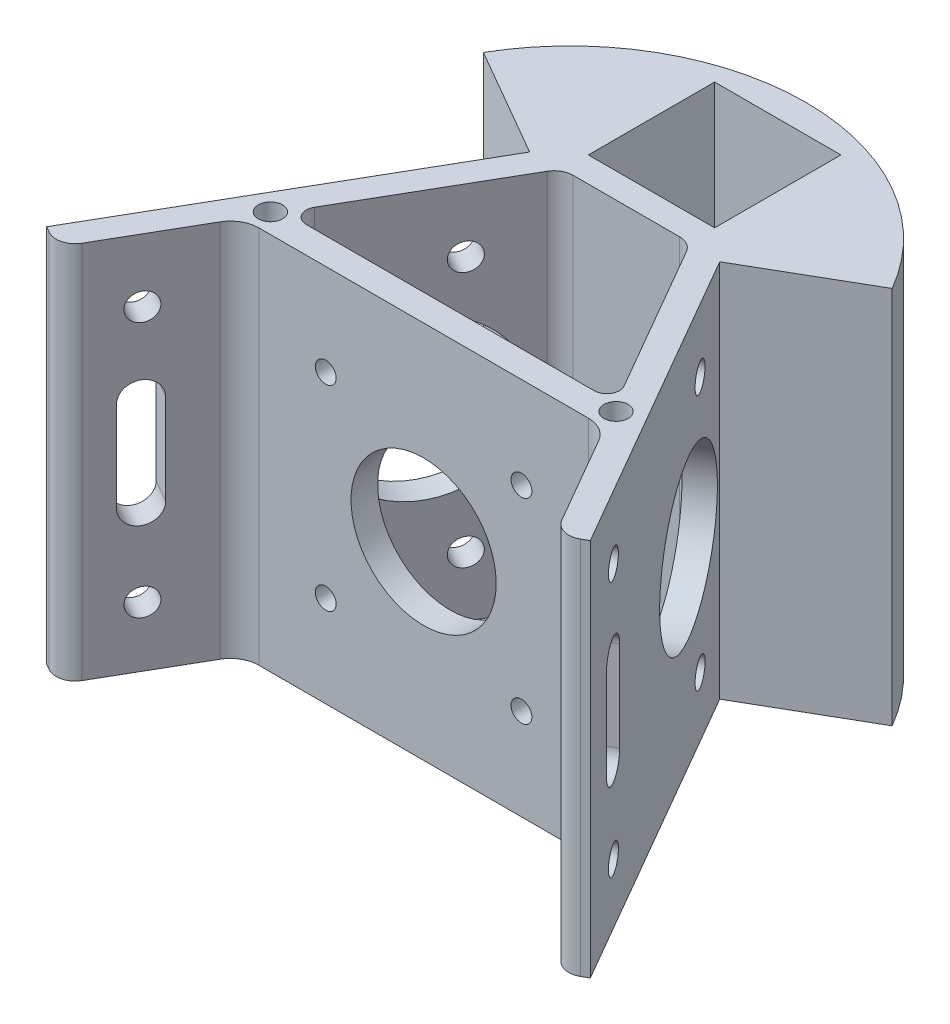
from build123d import *

# Parameters (mm, degrees)
BOSS_EXTRUDE1_DEPTH                = 60
SKETCH2_W                          = 15
SKETCH2_H                          = 20
CUT_EXTRUDE1_DEPTH                 = 85.888209544
CUT_EXTRUDE2_REACH                 = 85.66
SKETCH4_W                          = 2.5
SKETCH4_H                          = 20
CUT_EXTRUDE3_REACH                 = 85.66
SKETCH6_W                          = 2.5
SKETCH6_H                          = 20
CUT_EXTRUDE4_DEPTH                 = 98.632993582
CUT_EXTRUDE5_DEPTH                 = 95.486300493
CUT_EXTRUDE6_DEPTH                 = 85.888209544
F_4_3_4_3_DIAMETER_HOLE1_D         = 4.3
F_4_3_4_3_DIAMETER_HOLE1_DEPTH     = 75.600067507
F_4_3_4_3_DIAMETER_HOLE2_D         = 4.3
F_4_3_4_3_DIAMETER_HOLE2_DEPTH     = 75.600067507
F_4_3_4_3_DIAMETER_HOLE3_D         = 4.3
F_4_3_4_3_DIAMETER_HOLE3_DEPTH     = 4.11
F_25_0_START                       = -17.38342993
F_25_0_25_DIAMETER_HOLE1_DEPTH     = 16.551366025
F_4_3_4_3_DIAMETER_HOLE4_D         = 4.3
F_4_3_4_3_DIAMETER_HOLE4_DEPTH     = 4.11
F_25_0_START_2                     = 0.832063905
F_25_0_25_DIAMETER_HOLE2_OUTLINE_R = 12.5
F_25_0_25_DIAMETER_HOLE2_DEPTH     = 16.551366025
F_23_0_23_DIAMETER_HOLE1_D         = 23
F_23_0_23_DIAMETER_HOLE1_DEPTH     = 4.22
F_3_3_3_3_DIAMETER_HOLE1_D         = 3.3
F_3_3_3_3_DIAMETER_HOLE1_DEPTH     = 4.22
M3_5_CLEARANCE_HOLE1_D             = 3.85
FILLET1_R                          = 3
FILLET2_R                          = 4.5


# Read off the part's stored shape, not the designer's step: Ø25.0 (25) Diameter Hole1, Ø25.0 (25) Diameter Hole2
with BuildPart() as part:
    # Sketch1 → Boss-Extrude1 (new body)
    with BuildSketch(Plane.XZ):
        with BuildLine():
            Line((32.375, -18.691714965), (15.054491924, -8.691714965))
            Line((15.054491924, -8.691714965), (43.054491924, 39.805707647))
            Line((43.054491924, 39.805707647), (39.495127515, 41.860707647))
            Line((39.495127515, 41.860707647), (28.69628865, 23.15657007))
            Line((28.69628865, 23.15657007), (-28.69628865, 23.15657007))
            Line((-28.69628865, 23.15657007), (-39.495127515, 41.860707647))
            Line((-39.495127515, 41.860707647), (-43.054491924, 39.805707647))
            Line((-43.054491924, 39.805707647), (-15.054491924, -8.691714965))
            Line((-15.054491924, -8.691714965), (-32.375, -18.691714965))
            ThreePointArc((-32.375, -18.691714965), (0, -37.38342993), (32.375, -18.691714965))
        make_face()
    extrude(amount=-BOSS_EXTRUDE1_DEPTH)

    # Sketch2 → Cut-Extrude1 (cut, through all)
    with BuildSketch(Plane.XZ):
        with Locations((0, -22.94342993)):
            Rectangle(SKETCH2_W, SKETCH2_H)
    extrude(amount=-CUT_EXTRUDE1_DEPTH, mode=Mode.SUBTRACT)

    # Sketch4 → Cut-Extrude2 (cut, up to next)
    with BuildSketch(Plane.XZ.offset(-1.75), mode=Mode.PRIVATE) as cut_extrude2_sk1:
        with Locations((8.75, -22.94342993)):
            Rectangle(SKETCH4_W, SKETCH4_H)
    cut_extrude2_tool1 = extrude(cut_extrude2_sk1.sketch, amount=-CUT_EXTRUDE2_REACH, mode=Mode.PRIVATE) & part.part
    add(cut_extrude2_tool1.solids().sort_by_distance((8.75, 1.75, -22.94343))[0], mode=Mode.SUBTRACT)

    # Sketch6 → Cut-Extrude3 (cut, up to next)
    with BuildSketch(Plane.XZ.offset(-1.75), mode=Mode.PRIVATE) as cut_extrude3_sk1:
        with Locations((-8.75, -22.94342993)):
            Rectangle(SKETCH6_W, SKETCH6_H)
    cut_extrude3_tool1 = extrude(cut_extrude3_sk1.sketch, amount=-CUT_EXTRUDE3_REACH, mode=Mode.PRIVATE) & part.part
    add(cut_extrude3_tool1.solids().sort_by_distance((-8.75, 1.75, -22.94343))[0], mode=Mode.SUBTRACT)

    # Sketch7 → Cut-Extrude4 (cut, through all)
    with BuildSketch(Plane(origin=(15.054491924, 0, -8.691714965), x_dir=(-0.4999999999999995, 0, -0.866025403784439), z_dir=(0.8660254037844389, 0, -0.49999999999999944))):
        with BuildLine():
            Line((-49, 37.15), (-49, 22.85))
            ThreePointArc((-49, 22.85), (-46.15, 20), (-43.3, 22.85))
            Line((-43.3, 22.85), (-43.3, 37.15))
            ThreePointArc((-43.3, 37.15), (-46.15, 40), (-49, 37.15))
        make_face()
    extrude(amount=-CUT_EXTRUDE4_DEPTH, mode=Mode.SUBTRACT)

    # Sketch8 → Cut-Extrude5 (cut, through all)
    with BuildSketch(Plane(origin=(-11.495127515, 0, -6.636714965), x_dir=(0.5000000000000004, 0, -0.8660254037844385), z_dir=(0.8660254037844384, 0, 0.5000000000000003))):
        with BuildLine():
            Line((-49, 37.15), (-49, 22.85))
            ThreePointArc((-49, 22.85), (-46.15, 20), (-43.3, 22.85))
            Line((-43.3, 22.85), (-43.3, 37.15))
            ThreePointArc((-43.3, 37.15), (-46.15, 40), (-49, 37.15))
        make_face()
    extrude(amount=-CUT_EXTRUDE5_DEPTH, mode=Mode.SUBTRACT)

    # Sketch9 → Cut-Extrude6 (cut, through all)
    with BuildSketch(Plane(origin=(0, 60, 0), x_dir=(-1, 0, 0), z_dir=(0, 1, 0))):
        with BuildLine():
            Line((22.795768899, 18.93657007), (-22.795768899, 18.93657007))
            ThreePointArc((-22.795768899, 18.93657007), (-24.527819706, 17.93657007), (-24.527819706, 15.93657007))
            Line((-24.527819706, 15.93657007), (-10.163345009, -8.94342993))
            Line((-10.163345009, -8.94342993), (10.163345009, -8.94342993))
            Line((10.163345009, -8.94342993), (24.527819706, 15.93657007))
            ThreePointArc((24.527819706, 15.93657007), (24.527819706, 17.93657007), (22.795768899, 18.93657007))
        make_face()
    extrude(amount=-CUT_EXTRUDE6_DEPTH, mode=Mode.SUBTRACT)

    # Ø4.3 (4.3) Diameter Hole1
    with Locations(Plane(origin=(-15.054491924, 0, -8.691714965), x_dir=(-0.5000000000000003, 0, 0.8660254037844385), z_dir=(-0.8660254037844385, 0, -0.5000000000000003))):
        with Locations((46, 9.48944756), (46, 50)):
            Hole(F_4_3_4_3_DIAMETER_HOLE1_D / 2, depth=F_4_3_4_3_DIAMETER_HOLE1_DEPTH)

    # Ø4.3 (4.3) Diameter Hole2
    with Locations(Plane(origin=(15.054491924, 0, -8.691714965), x_dir=(-0.4999999999999995, 0, -0.866025403784439), z_dir=(0.8660254037844389, 0, -0.49999999999999944))):
        with Locations((-46, 9.48944756), (-46, 50)):
            Hole(F_4_3_4_3_DIAMETER_HOLE2_D / 2, depth=F_4_3_4_3_DIAMETER_HOLE2_DEPTH)

    # Ø4.3 (4.3) Diameter Hole3
    with Locations(Plane(origin=(-15.054491924, 0, -8.691714965), x_dir=(-0.5000000000000003, 0, 0.8660254037844385), z_dir=(-0.8660254037844385, 0, -0.5000000000000003))):
        with Locations((8.5, 9.48944756), (8.5, 50)):
            Hole(F_4_3_4_3_DIAMETER_HOLE3_D / 2, depth=F_4_3_4_3_DIAMETER_HOLE3_DEPTH)

    # Ø25.0 (25) Diameter Hole1 outline → Ø25.0 (25) Diameter Hole1 (cut)
    with BuildSketch(Plane(origin=(0, 0, 0), x_dir=(0.5000000000000003, 0, -0.8660254037844385), z_dir=(0.8660254037844385, 0, 0.5000000000000003)).offset(F_25_0_START)):
        with BuildLine():
            ThreePointArc((-22.346459974, 21.168797028), (-1, 30), (-22.346459974, 38.831202972))
            ThreePointArc((-22.346459974, 38.831202972), (-26, 30), (-22.346459974, 21.168797028))
        make_face()
    extrude(amount=F_25_0_25_DIAMETER_HOLE1_DEPTH, mode=Mode.SUBTRACT)

    # Ø4.3 (4.3) Diameter Hole4
    with Locations(Plane(origin=(15.054491924, 0, -8.691714965), x_dir=(-0.4999999999999995, 0, -0.866025403784439), z_dir=(0.8660254037844389, 0, -0.49999999999999944))):
        with Locations((-8.5, 9.48944756), (-8.5, 50)):
            Hole(F_4_3_4_3_DIAMETER_HOLE4_D / 2, depth=F_4_3_4_3_DIAMETER_HOLE4_DEPTH)

    # Ø25.0 (25) Diameter Hole2 outline → Ø25.0 (25) Diameter Hole2 (cut)
    with BuildSketch(Plane(origin=(0, 0, 0), x_dir=(0.49999999999999956, 0, 0.8660254037844389), z_dir=(0.8660254037844388, 0, -0.4999999999999999)).offset(F_25_0_START_2)):
        with Locations((13.5, -30)):
            Circle(F_25_0_25_DIAMETER_HOLE2_OUTLINE_R)
    extrude(amount=F_25_0_25_DIAMETER_HOLE2_DEPTH, mode=Mode.SUBTRACT)

    # Ø23.0 (23) Diameter Hole1
    with Locations(Plane.XY.offset(23.15657007)):
        with Locations((0, 30)):
            Hole(F_23_0_23_DIAMETER_HOLE1_D / 2, depth=F_23_0_23_DIAMETER_HOLE1_DEPTH)

    # Ø3.3 (3.3) Diameter Hole1
    with Locations(Plane.XY.offset(23.15657007)):
        with Locations((15.5, 45.5), (15.5, 14.5), (-15.5, 14.5), (-15.5, 45.5)):
            Hole(F_3_3_3_3_DIAMETER_HOLE1_D / 2, depth=F_3_3_3_3_DIAMETER_HOLE1_DEPTH)

    # M3.5 Clearance Hole1 (through all)
    with Locations(Plane(origin=(0, 0, 0), x_dir=(-1, 0, 0), z_dir=(0, -1, 0))):
        with Locations((-27.375, -20.045794742), (27.375, -20.045794742)):
            Hole(M3_5_CLEARANCE_HOLE1_D / 2)

    # Fillet1
    fillet1_edges = [part.edges().sort_by_distance(p)[0] for p in [
        (-10.163345009, 30, -8.94342993),
        (10.163345009, 30, -8.94342993),
        (-39.495127515, 30, 41.860707647),
        (39.495127515, 30, 41.860707647),
    ]]
    fillet(fillet1_edges, radius=FILLET1_R)

    # Fillet2
    fillet2_edges = [part.edges().sort_by_distance(p)[0] for p in [
        (-28.69628865, 30, 23.15657007),
        (28.69628865, 30, 23.15657007),
    ]]
    fillet(fillet2_edges, radius=FILLET2_R)


solid = part.part
